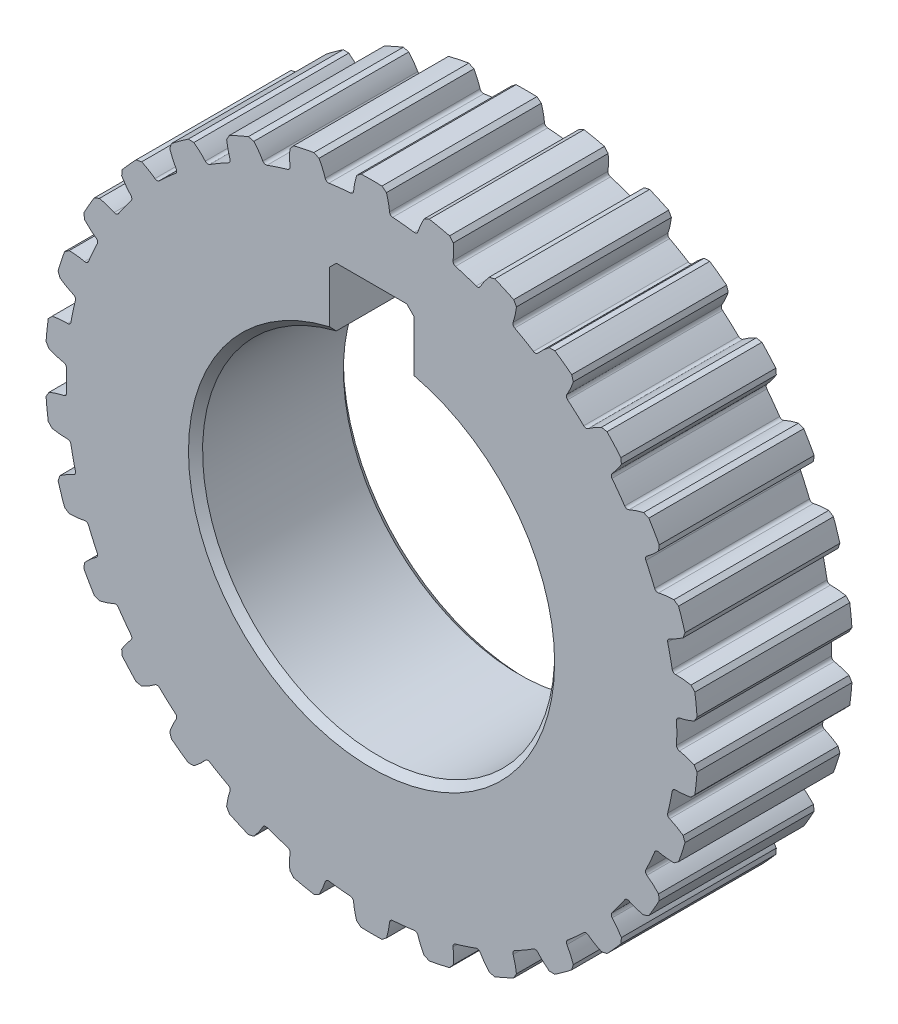
from build123d import *

# Parameters (mm, degrees)
SKETCH1_R            = 43.35
BOSS_EXTRUDE2_DEPTH  = 22
BOSS_EXTRUDE4_DEPTH  = 22
CHAMFER1_START       = -39
CHAMFER1_OUTLINE_W   = 7
CHAMFER1_OUTLINE_H   = 24
CHAMFER1_DEPTH       = 1.135972464
CHAMFER1_START_2     = 37.864027697
CHAMFER1_2_OUTLINE_W = 7
CHAMFER1_2_OUTLINE_H = 24
CHAMFER1_2_DEPTH     = 1.135972303
CIRPATTERN1_COUNT    = 30
CHAMFER2_SIZE        = 1
CHAMFER3_SIZE        = 1


with BuildPart() as part:
    # Sketch1 → Boss-Extrude2 (new body)
    with BuildSketch(Plane.XY):
        Circle(SKETCH1_R)
        with BuildLine():
            Line((6, 24.269322199), (6, 33.6))
            Line((6, 33.6), (-6, 33.6))
            Line((-6, 33.6), (-6, 24.269322199))
            ThreePointArc((-6, 24.269322199), (0, -25), (6, 24.269322199))
        make_face(mode=Mode.SUBTRACT)
    extrude(amount=BOSS_EXTRUDE2_DEPTH)

    # Sketch2 → Boss-Extrude4 (add)
    with BuildSketch(Plane.XY):
        with BuildLine():
            ThreePointArc((-2.999666532, 43.246092268), (0, 43.349999951), (2.999666532, 43.246092268))
            ThreePointArc((2.999666532, 43.246092268), (2.69556567, 43.383444184), (2.55446958, 43.685826023))
            ThreePointArc((2.55446958, 43.685826023), (2.554356136, 43.687238876), (2.554246864, 43.688652058))
            add(Edge.make_bspline(
                [(2.55424686, 43.688652107), (2.540945996, 43.860398766), (2.489524615, 44.274097607), (2.353745351, 44.987757735), (2.170170013, 45.687904435), (2.025611891, 46.1470419), (1.972241372, 46.308020514)],
                knots=[0.111115789, 0.111115789, 0.111115789, 0.111115789, 0.250004425, 0.444447944, 0.694446453, 0.830527411, 0.830527411, 0.830527411, 0.830527411], degree=3))
            ThreePointArc((1.972241372, 46.308020514), (-2e-09, 46.35), (-1.972241376, 46.308020514))
            add(Edge.make_bspline(
                [(-2.554469579, 43.685826024), (-2.554392312, 43.686770842), (-2.541063649, 43.859454703), (-2.489524415, 44.274097594), (-2.353745433, 44.987757742), (-2.17017, 45.687904427), (-2.025611893, 46.147041898), (-1.972241376, 46.308020514)],
                knots=[0.110355108, 0.110355108, 0.110355108, 0.110355108, 0.111115789, 0.250004425, 0.444447944, 0.694446453, 0.830527408, 0.830527408, 0.830527408, 0.830527408], degree=3))
            ThreePointArc((-2.554469579, 43.685826024), (-2.69556567, 43.383444184), (-2.999666532, 43.246092268))
        make_face()
    boss_extrude4 = extrude(amount=BOSS_EXTRUDE4_DEPTH)

    # Chamfer1: read off the stored shape, not the designer's step
    # Chamfer1 outline → Chamfer1 (cut)
    with BuildSketch(Plane(origin=(0, 0, 0), x_dir=(0.7981288711401181, 0.6024867675331971, 0), z_dir=(0.6024867675331971, -0.7981288711401182, 0)).offset(CHAMFER1_START)):
        with Locations((27.5, 11)):
            Rectangle(CHAMFER1_OUTLINE_W, CHAMFER1_OUTLINE_H)
    chamfer1 = extrude(amount=CHAMFER1_DEPTH, mode=Mode.SUBTRACT)

    # Chamfer1 2 outline → Chamfer1 2 (cut)
    with BuildSketch(Plane(origin=(0, 0, 0), x_dir=(0.7981288748275028, -0.6024867626484289, 0), z_dir=(0.6024867626484289, 0.7981288748275028, 0)).offset(CHAMFER1_START_2)):
        with Locations((-27.5, -11)):
            Rectangle(CHAMFER1_2_OUTLINE_W, CHAMFER1_2_OUTLINE_H)
    chamfer1_2 = extrude(amount=CHAMFER1_2_DEPTH, mode=Mode.SUBTRACT)

    # CirPattern1: Boss-Extrude4, Chamfer1, Chamfer1 2 ×30 about axis
    cirpattern1_axis = Axis((0, 0, 22), (0, 0, -1))
    add([boss_extrude4.rotate(cirpattern1_axis, i * 360 / CIRPATTERN1_COUNT) for i in range(1, CIRPATTERN1_COUNT)])
    add([chamfer1.rotate(cirpattern1_axis, i * 360 / CIRPATTERN1_COUNT) for i in range(1, CIRPATTERN1_COUNT)], mode=Mode.SUBTRACT)
    add([chamfer1_2.rotate(cirpattern1_axis, i * 360 / CIRPATTERN1_COUNT) for i in range(1, CIRPATTERN1_COUNT)], mode=Mode.SUBTRACT)

    # Chamfer2
    chamfer2_edges = [part.edges().sort_by_distance(p)[0] for p in [
        (6, 33.6, 11),
        (-6, 33.6, 11),
    ]]
    chamfer(chamfer2_edges, length=CHAMFER2_SIZE)

    # Chamfer3
    chamfer3_edges = [part.edges().sort_by_distance(p)[0] for p in [
        (0, -25, 22),
        (0, -25, 0),
    ]]
    chamfer(chamfer3_edges, length=CHAMFER3_SIZE)


solid = part.part
